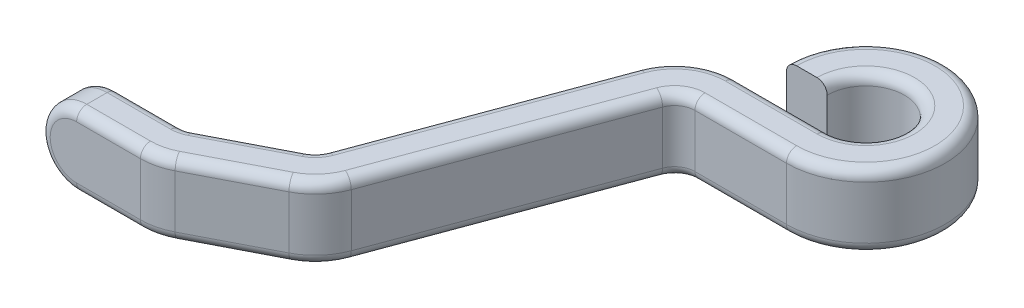
from build123d import *

# Parameters (mm, degrees)
BASE_EXTRUDE_DEPTH = 1
SKETCH3_W          = 1
SKETCH3_H          = 1.8
FILLET2_R          = 0.25
FILLET3_R          = 0.25


with BuildPart() as part:
    # Sketch1 → Base-Extrude (new body)
    with BuildSketch(Plane.XY):
        with BuildLine():
            Line((5.305323422, 0.9), (3.996041137, 0.9))
            ThreePointArc((3.996041137, 0.9), (3.096041137, 0), (3.996041137, -0.9))
            Line((3.996041137, -0.9), (5.305323422, -0.9))
            Line((5.305323422, -0.9), (5.305323422, 0.9))
        make_face()
    extrude(amount=BASE_EXTRUDE_DEPTH)

    # Boss-Sweep1: sweep along a path in Sketch2
    with BuildLine(Plane(origin=(0, 0, 0), x_dir=(1, 0, 0), z_dir=(0, 1, 0))) as boss_sweep1_path:
        Line((5.305323422, -0.5), (5.562500347, -0.5))
        ThreePointArc((5.562500347, -0.5), (5.798466413, -0.471761296), (6.021105728, -0.388640031))
        Line((6.021105728, -0.388640031), (7.866380982, 0.563661386))
        ThreePointArc((7.866380982, 0.563661386), (8.156658179, 0.789598704), (8.34560518, 1.105205347))
        Line((8.34560518, 1.105205347), (10.412481631, 6.689762596))
        ThreePointArc((10.412481631, 6.689762596), (10.778951458, 7.163366249), (11.350311209, 7.342666526))
        Line((11.350311209, 7.342666526), (13.600311209, 7.342666526))
        ThreePointArc((13.600311209, 7.342666526), (14.625616042, 9.817971359), (12.150311209, 8.792666526))
    # Sketch3 → Boss-Sweep1 (sweep)
    with BuildSketch(Plane(origin=(5.305323422, 0, 0), x_dir=(0, 0, -1), z_dir=(1, 0, 0))):
        with Locations((-0.5, 0)):
            Rectangle(SKETCH3_W, SKETCH3_H)
    sweep(path=boss_sweep1_path.line)

    # Fillet2
    fillet2_edges = [part.edges().sort_by_distance(p)[0] for p in [
        (14.979169433, -0.9, -10.17152475),
        (12.475311209, -0.9, -6.842666526),
        (11.064631334, -0.9, -6.753016388),
        (9.847958195, -0.9, -3.723935937),
        (4.779270742, -0.9, 1),
        (3.096041137, 0, 1),
        (14.979169433, 0.9, -10.17152475),
        (4.779270742, 0.9, 1),
        (12.475311209, 0.9, -6.842666526),
        (11.064631334, 0.9, -6.753016388),
        (9.847958195, 0.9, -3.723935937),
        (8.531099467, -0.9, -0.458247348),
        (7.173046045, -0.9, 0.356809338),
        (5.916449446, -0.9, 0.957641943),
        (5.916449446, 0.9, 0.957641943),
        (7.173046045, 0.9, 0.356809338),
        (8.531099467, 0.9, -0.458247348),
    ]]
    fillet(fillet2_edges, radius=FILLET2_R)

    # Fillet3
    fillet3_edges = [part.edges().sort_by_distance(p)[0] for p in [
        (14.272062652, -0.9, -9.464417969),
        (12.475311209, -0.9, -7.842666526),
        (10.493271583, -0.9, -7.57371611),
        (8.910128616, -0.9, -4.071032006),
        (4.779270742, -0.9, 0),
        (3.096041137, 0, 0),
        (14.272062652, 0.9, -9.464417969),
        (4.779270742, 0.9, 0),
        (12.475311209, 0.9, -7.842666526),
        (10.493271583, 0.9, -7.57371611),
        (8.910128616, 0.9, -4.071032006),
        (7.78221689, -0.9, -1.120950061),
        (6.714440665, -0.9, -0.531830693),
        (5.68048338, -0.9, -0.014119352),
        (5.68048338, 0.9, -0.014119352),
        (6.714440665, 0.9, -0.531830693),
        (7.78221689, 0.9, -1.120950061),
    ]]
    fillet(fillet3_edges, radius=FILLET3_R)


solid = part.part
